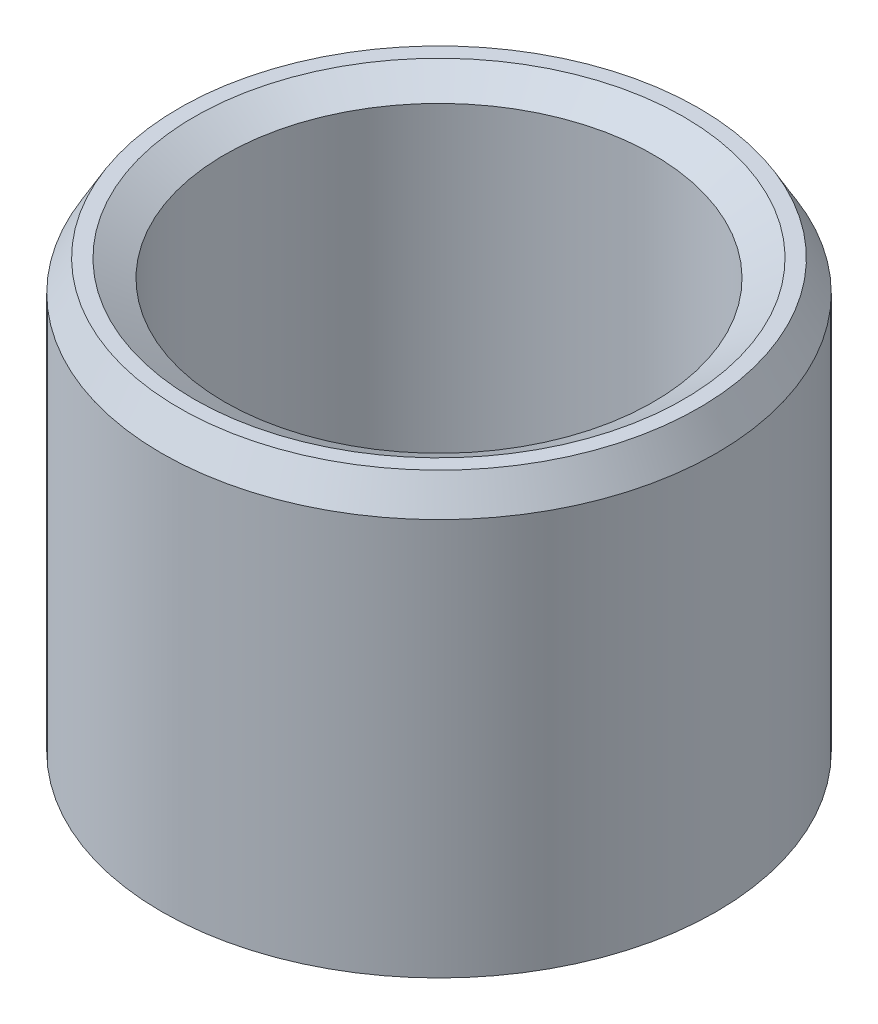
from build123d import *
from OCP.BRepFilletAPI import BRepFilletAPI_MakeChamfer

# Parameters (mm, degrees)
SKETCH1_R           = 15
BOSS_EXTRUDE1_DEPTH = 24.06085588
SKETCH2_R           = 11.588546068
CUT_EXTRUDE1_DEPTH  = 33.076857478
CHAMFER1_SIZE       = 1.645344367
CHAMFER1_SIZE2      = 0.949940013


with BuildPart() as part:
    # Sketch1 → Boss-Extrude1 (new body)
    with BuildSketch(Plane(origin=(0, 0, 0), x_dir=(1, 0, 0), z_dir=(0, 1, 0))):
        Circle(SKETCH1_R)
    extrude(amount=BOSS_EXTRUDE1_DEPTH)

    # Sketch2 → Cut-Extrude1 (cut, through all)
    with BuildSketch(Plane(origin=(0, 0, 0), x_dir=(1, 0, 0), z_dir=(0, 1, 0))):
        Circle(SKETCH2_R)
    extrude(amount=CUT_EXTRUDE1_DEPTH, mode=Mode.SUBTRACT)

    # Chamfer1: one chamfer whose edges measure the first distance from different faces: ONE call of the kernel's chamfer builder (chamfer() names one face for all edges)
    chamfer1_edges_1 = [part.edges().sort_by_distance(p)[0] for p in [
        (-11.588546068, 24.06085588, 0),
    ]]
    chamfer1_side_1 = [part.faces().sort_by_distance(p)[0] for p in [
        (-14.575735931, 24.06085588, 0),
    ]]
    chamfer1_edges_2 = [part.edges().sort_by_distance(p)[0] for p in [
        (-11.588546068, 0, 0),
    ]]
    chamfer1_side_2 = [part.faces().sort_by_distance(p)[0] for p in [
        (-11.588546068, 12.03042794, 0),
    ]]
    chamfer1_edges_3 = [part.edges().sort_by_distance(p)[0] for p in [
        (-15, 0, 0),
    ]]
    chamfer1_side_3 = [part.faces().sort_by_distance(p)[0] for p in [
        (-14.575735931, 0, 0),
    ]]
    chamfer1_edges_4 = [part.edges().sort_by_distance(p)[0] for p in [
        (-15, 24.06085588, 0),
    ]]
    chamfer1_side_4 = [part.faces().sort_by_distance(p)[0] for p in [
        (-15, 12.03042794, 0),
    ]]
    chamfer1 = BRepFilletAPI_MakeChamfer(part.part.solid().wrapped)
    for e in chamfer1_edges_1:
        chamfer1.Add(CHAMFER1_SIZE, CHAMFER1_SIZE2, e.wrapped, chamfer1_side_1[0].wrapped)  # the first distance lies on this face
    for e in chamfer1_edges_2:
        chamfer1.Add(CHAMFER1_SIZE, CHAMFER1_SIZE2, e.wrapped, chamfer1_side_2[0].wrapped)  # the first distance lies on this face
    for e in chamfer1_edges_3:
        chamfer1.Add(CHAMFER1_SIZE, CHAMFER1_SIZE2, e.wrapped, chamfer1_side_3[0].wrapped)  # the first distance lies on this face
    for e in chamfer1_edges_4:
        chamfer1.Add(CHAMFER1_SIZE, CHAMFER1_SIZE2, e.wrapped, chamfer1_side_4[0].wrapped)  # the first distance lies on this face
    add(Compound.cast(chamfer1.Shape()), mode=Mode.REPLACE)


solid = part.part
